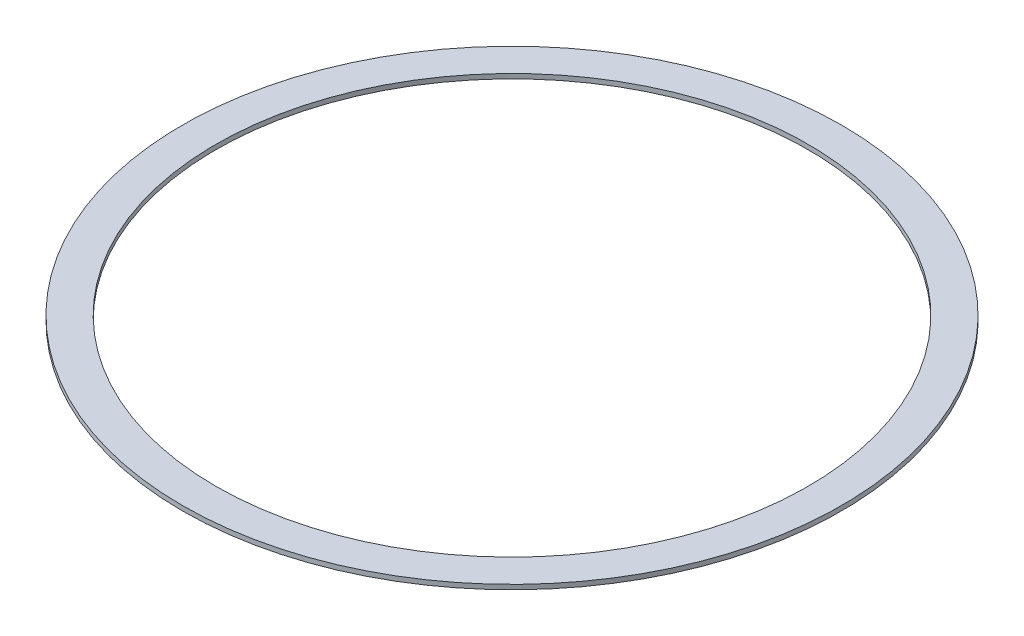
from build123d import *

# Parameters (mm, degrees)
SKETCH1_R           = 179.0446
SKETCH1_R_2         = 160.909
BOSS_EXTRUDE1_DEPTH = 2.54


with BuildPart() as part:
    # Sketch1 → Boss-Extrude1 (new body)
    with BuildSketch(Plane(origin=(0, 0, 0), x_dir=(1, 0, 0), z_dir=(0, 1, 0))):
        Circle(SKETCH1_R)
        Circle(SKETCH1_R_2, mode=Mode.SUBTRACT)
    extrude(amount=BOSS_EXTRUDE1_DEPTH)


solid = part.part
